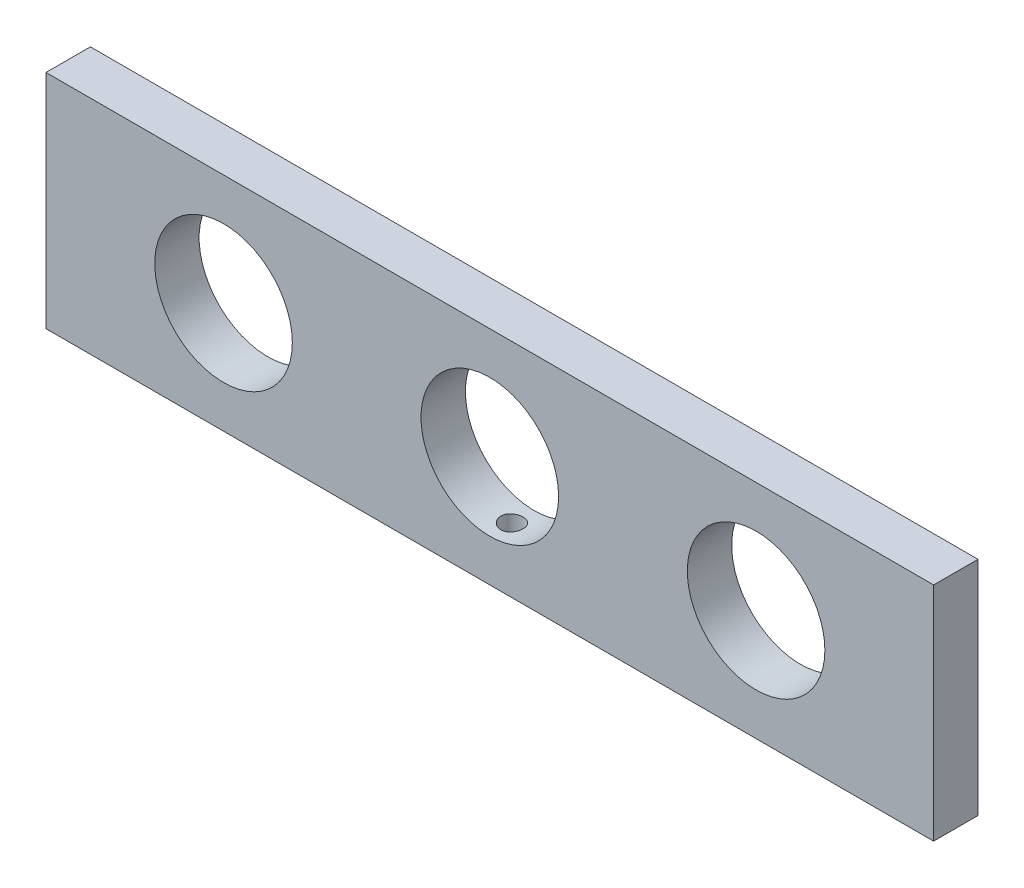
from build123d import *

# Parameters (mm, degrees)
SKETCH1_W           = 200
SKETCH1_H           = 50
SKETCH1_R           = 15.5
BOSS_EXTRUDE1_DEPTH = 10
SKETCH2_R           = 2.5
CUT_EXTRUDE1_DEPTH  = 10


with BuildPart() as part:
    # Sketch1 → Boss-Extrude1 (new body)
    with BuildSketch(Plane.XY):
        Rectangle(SKETCH1_W, SKETCH1_H)
        Circle(SKETCH1_R, mode=Mode.SUBTRACT)
        with Locations((60, 0)):
            Circle(SKETCH1_R, mode=Mode.SUBTRACT)
        with Locations((-60, 0)):
            Circle(SKETCH1_R, mode=Mode.SUBTRACT)
    extrude(amount=BOSS_EXTRUDE1_DEPTH)

    # Sketch2 → Cut-Extrude1 (cut)
    with BuildSketch(Plane.XZ.offset(25)):
        with Locations((-95, 5)):
            Circle(SKETCH2_R)
        with Locations((0, 5)):
            Circle(SKETCH2_R)
        with Locations((95, 5)):
            Circle(SKETCH2_R)
    extrude(amount=-CUT_EXTRUDE1_DEPTH, mode=Mode.SUBTRACT)


solid = part.part
